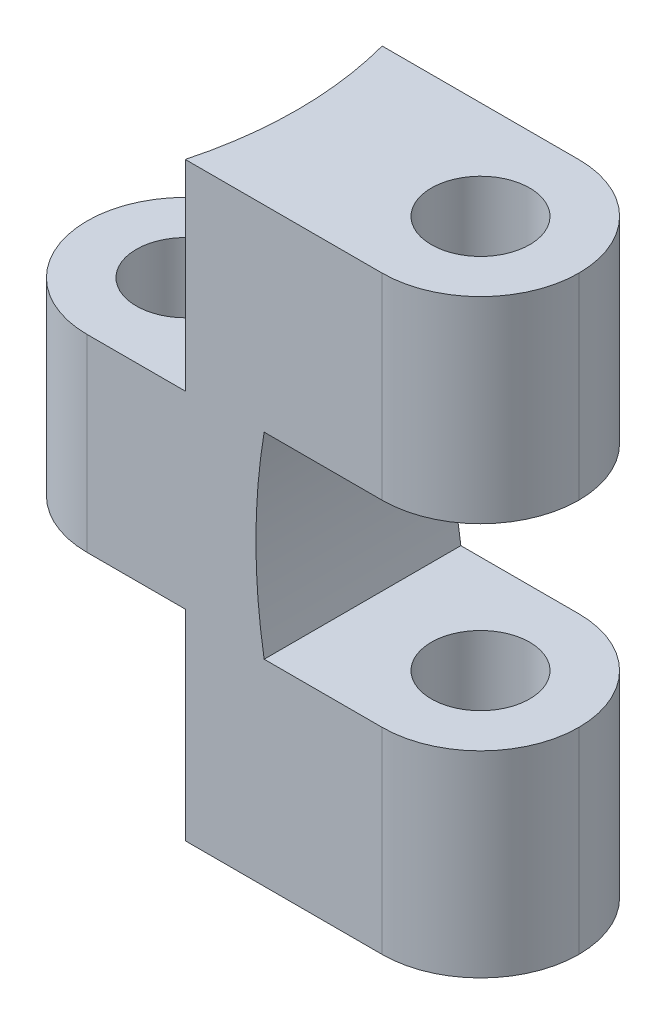
from build123d import *

# Parameters (mm, degrees)
RESSALTO_EXTRUS_O1_DEPTH = 10
ESBO_O2_R                = 2.5
CORTE_EXTRUS_O1_DEPTH    = 10
FILETE1_R                = 5
CORTE_EXTRUS_O4_DEPTH    = 10
CORTE_EXTRUS_O5_DEPTH    = 10
CORTE_EXTRUS_O6_REACH    = 39.417
ESBO_O7_W                = 15
ESBO_O7_H                = 10
ESBO_O8_W                = 11
ESBO_O8_H                = 10
CORTE_EXTRUS_O7_DEPTH    = 27.925824036
CORTE_EXTRUS_O8_DEPTH    = 20
CORTE_EXTRUS_O9_REACH    = 39.417
ESBO_O10_R               = 2.5
FILETE2_R                = 5


with BuildPart() as part:
    # Esboço1 → Ressalto-extrusão1 (new body)
    with BuildSketch(Plane.XY):
        Polygon((-10, -7.5), (20, 15), (-10, 15), (-10, 4.8), (-20, 4.8), (-20, -4.8), (-10, -4.8), align=None)
        Polygon((20, -15), (20, 15), (-10, -7.5), (-10, -15), align=None)
    extrude(amount=RESSALTO_EXTRUS_O1_DEPTH)

    # Esboço2 → Corte-extrusão1 (cut)
    with BuildSketch(Plane.XZ.offset(4.8)):
        with Locations(Location((-15, 5, 0), (0, 0, 270))):
            Circle(ESBO_O2_R)
    extrude(amount=-CORTE_EXTRUS_O1_DEPTH, mode=Mode.SUBTRACT)

    # Filete1
    filete1_edges = [part.edges().sort_by_distance(p)[0] for p in [
        (-20, 0, 0),
        (-20, 0, 10),
    ]]
    fillet(filete1_edges, radius=FILETE1_R - 0.0001)  # a hair under: the kernel refuses the full size

    # Esboço5 → Corte-extrusão4 (cut)
    with BuildSketch(Plane.XZ.offset(15)):
        with BuildLine():
            Line((-10, 10), (-10, 0))
            ThreePointArc((-10, 0), (-9.341737512, 5), (-10, 10))
        make_face()
    extrude(amount=-CORTE_EXTRUS_O4_DEPTH, mode=Mode.SUBTRACT)

    # Esboço6 → Corte-extrusão5 (cut)
    with BuildSketch(Plane(origin=(0, 15, 0), x_dir=(1, 0, 0), z_dir=(0, 1, 0))):
        with BuildLine():
            Line((-10, -9.950546275), (-10, 0))
            ThreePointArc((-10, 0), (-9.344992865, -4.975273137), (-10, -9.950546275))
        make_face()
    extrude(amount=-CORTE_EXTRUS_O5_DEPTH, mode=Mode.SUBTRACT)

    # Esboço7 → Corte-extrusão6 (cut, up to next)
    with BuildSketch(Plane(origin=(0, 15, 0), x_dir=(1, 0, 0), z_dir=(0, 1, 0)), mode=Mode.PRIVATE) as corte_extrus_o6_sk1:
        with Locations((12.5, -5)):
            Rectangle(ESBO_O7_W, ESBO_O7_H)
    corte_extrus_o6_tool1 = extrude(corte_extrus_o6_sk1.sketch, amount=-CORTE_EXTRUS_O6_REACH, mode=Mode.PRIVATE) & part.part
    add(corte_extrus_o6_tool1.solids().sort_by_distance((12.5, 15, 5))[0], mode=Mode.SUBTRACT)

    # Esboço8 → Corte-extrusão7 (cut, through all)
    with BuildSketch(Plane.XY.offset(10)):
        with Locations((-0.5, 0)):
            Rectangle(ESBO_O8_W, ESBO_O8_H)
    extrude(amount=-CORTE_EXTRUS_O7_DEPTH, mode=Mode.SUBTRACT)

    # Esboço9 → Corte-extrusão8 (cut)
    with BuildSketch(Plane(origin=(0, 0, 0), x_dir=(-1, 0, 0), z_dir=(0, 0, -1))):
        with BuildLine():
            Line((6, -5), (6, 5))
            ThreePointArc((6, 5), (6.419601085, 0), (6, -5))
        make_face()
    extrude(amount=-CORTE_EXTRUS_O8_DEPTH, mode=Mode.SUBTRACT)

    # Corte-extrusão9: up to this face of the body (flat: up to its plane)
    corte_extrus_o9_end = Plane(part.part.faces().sort_by_distance((-2.281136508, -15, 5))[0])
    # Esboço10 → Corte-extrusão9 (cut, up to the picked face)
    with BuildSketch(Plane(origin=(0, 15, 0), x_dir=(1, 0, 0), z_dir=(0, 1, 0)), mode=Mode.PRIVATE) as corte_extrus_o9_sk1:
        with Locations(Location((0, -5, 0), (0, 0, 180))):
            Circle(ESBO_O10_R)
    corte_extrus_o9_tool1 = split(extrude(corte_extrus_o9_sk1.sketch, amount=-CORTE_EXTRUS_O9_REACH, mode=Mode.PRIVATE), bisect_by=corte_extrus_o9_end, keep=Keep.BOTH, mode=Mode.PRIVATE)
    add(corte_extrus_o9_tool1.solids().sort_by(Axis((0, 15, 5), (0, -1, 0)))[0], mode=Mode.SUBTRACT)

    # Filete2
    filete2_edges = [part.edges().sort_by_distance(p)[0] for p in [
        (5, -10, 0),
        (5, -10, 10),
        (5, 10, 10),
        (5, 10, 0),
    ]]
    fillet(filete2_edges, radius=FILETE2_R - 0.0001)  # a hair under: the kernel refuses the full size


solid = part.part
